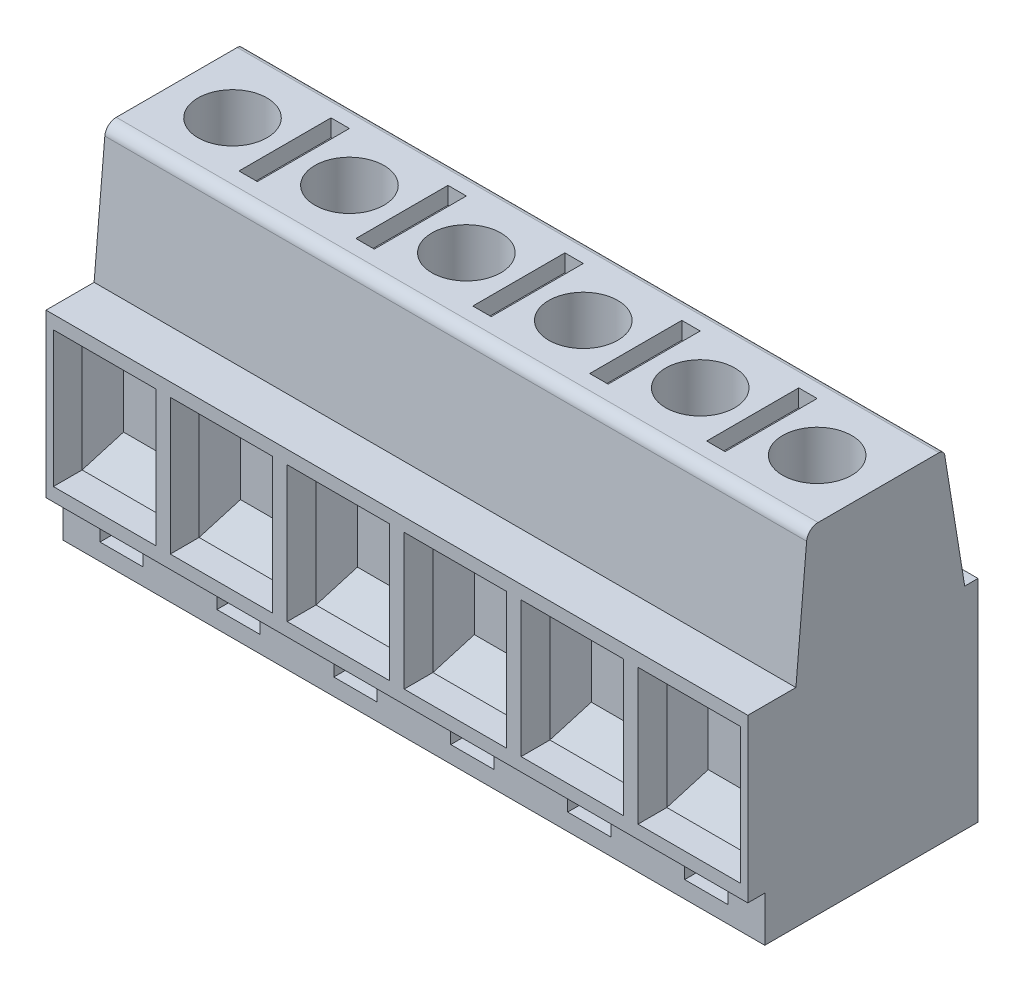
from build123d import *

# Parameters (mm, degrees)
BOSS_EXTRUDE1_DEPTH     = 10.16
SKETCH2_W               = 8.900000000000002
SKETCH2_H               = 11.800000000000011
CUT_EXTRUDE1_DEPTH      = 2.5
SKETCH5_R               = 2.9999999999999996
CUT_EXTRUDE2_DEPTH      = 5.7
SKETCH7_W               = 1.2999999999999998
SKETCH7_H               = 0.8000000000000007
SKETCH7_H_2             = 0.7999999999999936
BOSS_EXTRUDE2_DEPTH     = 4.5
CUT_EXTRUDE5_START      = -10.96
CUT_EXTRUDE5_DEPTH      = 10.96
SKETCH10_R              = 1.4999999999999998
CUT_EXTRUDE6_DEPTH      = 4.5
SKETCH13_W              = 3.75
SKETCH13_H              = 1
CUT_EXTRUDE8_DEPTH      = 3
FILLET3_R               = 0.5
FILLET4_R               = 1
SKETCH12_W              = 1.2999999999999998
SKETCH12_H              = 1.299999999999999
BOSS_EXTRUDE3_DEPTH     = 0.5
BOSS_EXTRUDE3_2_DEPTH   = 0.5
BOSS_EXTRUDE3_3_DEPTH   = 0.5
BOSS_EXTRUDE4_START     = 0.01
BOSS_EXTRUDE4_DEPTH     = 0.01
LPATTERN8_COUNT         = 6
LPATTERN8_PITCH         = 10.16
LPATTERN8_2_COUNT       = 6
LPATTERN8_2_PITCH       = 10.16
LPATTERN8_3_COUNT       = 6
LPATTERN8_3_PITCH       = 10.16
LPATTERN8_4_COUNT       = 6
LPATTERN8_4_PITCH       = 10.16
FILLET3_OF_LPATTERN8_R  = 0.5
FILLET4_OF_LPATTERN8_R  = 1
SKETCH11_W              = 1.6
SKETCH11_H              = 8
CUT_EXTRUDE7_DEPTH      = 1.5
LPATTERN9_START         = 57.041856165
LPATTERN9_OUTLINE_W     = 1.5999999999999943
LPATTERN9_OUTLINE_H     = 8
LPATTERN9_OUTLINE_W_2   = 1.5999999999999979
LPATTERN9_OUTLINE_W_3   = 1.6000000000000014
LPATTERN9_DEPTH         = 1.5
LPATTERN9_START_2       = 28.541856165
LPATTERN9_2_OUTLINE_W   = 1.2999999999999972
LPATTERN9_2_OUTLINE_H   = 1.299999999999999
LPATTERN9_2_OUTLINE_W_2 = 1.3000000000000007
LPATTERN9_2_OUTLINE_H_2 = 1.2999999999999972
LPATTERN9_2_OUTLINE_H_3 = 1.3000000000000007
LPATTERN9_2_DEPTH       = 0.5
BOSS_EXTRUDE6_DEPTH     = 0.01


# Read off the part's stored shape, not the designer's step: Cut-Extrude5, LPattern9
with BuildPart() as part:
    # Sketch1 → Boss-Extrude1 (new body)
    with BuildSketch(Plane(origin=(0, 0, 0), x_dir=(0, 0, -1), z_dir=(1, 0, 0))):
        Polygon((9.669213470381848, 32.96915259715871), (9.669213470381848, 47.08678337249189), (13.847501539912686, 47.08678337249189), (14.859335014289963, 58.54185616450892), (26.70903057031256, 58.54185616450892), (28.514863984729242, 47.38649061080074), (29.669213470381848, 47.38649061080074), (29.66921347038185, 29.041856164508925), (11.142277404209432, 29.04185616450892), (11.142277404209432, 32.96915259715871), align=None)
    boss_extrude1 = extrude(amount=BOSS_EXTRUDE1_DEPTH)

    # Sketch2 → Cut-Extrude1 (cut)
    with BuildSketch(Plane.XY.offset(-9.669213470381848)):
        with Locations((5.08, 40.0279679848253)):
            Rectangle(SKETCH2_W, SKETCH2_H)
    cut_extrude1 = extrude(amount=-CUT_EXTRUDE1_DEPTH, mode=Mode.SUBTRACT)

    # Sketch3 → Cut-Loft1 section 0
    with BuildSketch(Plane.XY.offset(-12.169213470381848)):
        with BuildLine():
            Line((9.530000000000001, 34.1279679848253), (9.530000000000001, 45.92796798482531))
            Line((9.530000000000001, 45.92796798482531), (0.6299999999999994, 45.92796798482531))
            Line((0.6299999999999994, 45.92796798482531), (0.6299999999999994, 34.1279679848253))
            Line((0.6299999999999994, 34.1279679848253), (9.530000000000001, 34.1279679848253))
        make_face()
    # Sketch4 → Cut-Loft1 section 1
    with BuildSketch(Plane.XY.offset(-14.069213470381849)):
        with BuildLine():
            Line((2.3299999999999987, 36.877967984825304), (7.829999999999998, 36.877967984825304))
            Line((7.829999999999998, 36.877967984825304), (7.829999999999998, 43.1779679848253))
            Line((7.829999999999998, 43.1779679848253), (2.3299999999999987, 43.1779679848253))
            Line((2.3299999999999987, 43.1779679848253), (2.3299999999999987, 36.877967984825304))
        make_face()
    cut_loft1 = loft(mode=Mode.SUBTRACT)

    # Sketch5 → Cut-Extrude2 (cut)
    with BuildSketch(Plane(origin=(0, 58.54185616450892, 0), x_dir=(1, 0, 0), z_dir=(0, 1, 0))):
        with Locations(Location((5.08, 20.784182792301262, 0), (0, 0, 270))):
            Circle(SKETCH5_R)
    cut_extrude2 = extrude(amount=-CUT_EXTRUDE2_DEPTH, mode=Mode.SUBTRACT)

    # Sketch7 → Boss-Extrude2 (add)
    with BuildSketch(Plane.XZ.offset(-29.041856164508918)):
        with Locations((5.08, -27.169213470381862)):
            Rectangle(SKETCH7_W, SKETCH7_H)
        with Locations((5.08, -17.00921347038186)):
            Rectangle(SKETCH7_W, SKETCH7_H_2)
    boss_extrude2 = extrude(amount=BOSS_EXTRUDE2_DEPTH)

    # Cut-Extrude5 outline → Cut-Extrude5 (cut)
    with BuildSketch(Plane.XY.offset(-16.60921347038186).offset(CUT_EXTRUDE5_START)):
        with BuildLine():
            Line((5.73, 24.541856165), (5.73, 25.191856165))
            ThreePointArc((5.73, 25.191856165), (5.539619408, 24.732236757), (5.08, 24.541856165))
            Line((5.08, 24.541856165), (5.73, 24.541856165))
        make_face()
        with BuildLine():
            Line((4.43, 24.541856165), (5.08, 24.541856165))
            ThreePointArc((5.08, 24.541856165), (4.620380592, 24.732236757), (4.43, 25.191856165))
            Line((4.43, 25.191856165), (4.43, 24.541856165))
        make_face()
    cut_extrude5 = extrude(amount=CUT_EXTRUDE5_DEPTH, mode=Mode.SUBTRACT)

    # Sketch10 → Cut-Extrude6 (cut)
    with BuildSketch(Plane(origin=(0, 38.527852040591384, -38.527852040591256), x_dir=(-1, 0, 0), z_dir=(0, 0.7071067811865488, -0.7071067811865464))):
        with Locations(Location((-5.08, 12.528006810151506, 0), (0, 0, 90))):
            Circle(SKETCH10_R)
    cut_extrude6 = extrude(amount=-CUT_EXTRUDE6_DEPTH, mode=Mode.SUBTRACT)

    # Sketch13 → Cut-Extrude8 (cut)
    with BuildSketch(Plane.XY.offset(-11.142277404209432)):
        with Locations((5.080000000000007, 31.005504380833823)):
            Rectangle(SKETCH13_W, SKETCH13_H)
    cut_extrude8 = extrude(amount=-CUT_EXTRUDE8_DEPTH, mode=Mode.SUBTRACT)

    # Fillet3
    fillet3_edges = [part.edges().sort_by_distance(p)[0] for p in [
        (5.08, 58.54185616450892, -26.70903057031256),
    ]]
    fillet(fillet3_edges, radius=FILLET3_R)

    # Fillet4
    fillet4_edges = [part.edges().sort_by_distance(p)[0] for p in [
        (5.08, 58.54185616450892, -14.859335014289963),
    ]]
    fillet(fillet4_edges, radius=FILLET4_R)

    # Sketch14 → Boss-Extrude4 (add)
    with BuildSketch(Plane(origin=(10.16, 0, 0), x_dir=(0, 0, -1), z_dir=(1, 0, 0)).offset(BOSS_EXTRUDE4_START)):
        with BuildLine():
            Line((14.77877644669124, 57.629844179105966), (13.847501539912686, 47.08678337249189))
            Line((13.847501539912686, 47.08678337249189), (9.669213470381848, 47.08678337249189))
            Line((9.669213470381848, 47.08678337249189), (9.669213470381848, 32.96915259715871))
            Line((9.669213470381848, 32.96915259715871), (11.142277404209432, 32.96915259715871))
            Line((11.142277404209432, 32.96915259715871), (11.142277404209432, 29.04185616450892))
            Line((11.142277404209432, 29.04185616450892), (29.66921347038185, 29.041856164508925))
            Line((29.66921347038185, 29.041856164508925), (29.669213470381848, 47.38649061080074))
            Line((29.669213470381848, 47.38649061080074), (28.514863984729242, 47.38649061080074))
            Line((28.514863984729242, 47.38649061080074), (26.777036465378647, 58.121756163471794))
            ThreePointArc((26.777036465378647, 58.121756163471794), (26.607537368480997, 58.42261199143836), (26.28346175961899, 58.54185616450892))
            Line((26.28346175961899, 58.54185616450892), (15.77489798008326, 58.54185616450892))
            ThreePointArc((15.77489798008326, 58.54185616450892), (15.09961582223998, 58.279415658582806), (14.77877644669124, 57.629844179105966))
        make_face()
    extrude(amount=-BOSS_EXTRUDE4_DEPTH)



with BuildPart() as body_2:
    # Sketch12 → Boss-Extrude3 (new body)
    with BuildSketch(Plane.XZ.offset(-29.041856164508918)):
        with Locations((3.9e-16, -15.192277404209438)):
            Rectangle(SKETCH12_W, SKETCH12_H)
    extrude(amount=BOSS_EXTRUDE3_DEPTH)


with BuildPart() as body_3:
    # Sketch12 → Boss-Extrude3 2 (new body)
    with BuildSketch(Plane.XZ.offset(-29.041856164508918)):
        Polygon((-0.6500000000000012, -20.342277404209444), (0.6499999999999989, -20.342277404209444), (0.649999999999998, -19.04227740420944), (-0.6500000000000012, -19.04227740420944), align=None)
    extrude(amount=BOSS_EXTRUDE3_2_DEPTH)


with BuildPart() as body_4:
    # Sketch12 → Boss-Extrude3 3 (new body)
    with BuildSketch(Plane.XZ.offset(-29.041856164508918)):
        Polygon((-0.6499999999999996, -25.042277404209447), (0.6500000000000006, -25.042277404209447), (0.6500000000000008, -23.742277404209442), (-0.6499999999999996, -23.742277404209442), align=None)
    extrude(amount=BOSS_EXTRUDE3_3_DEPTH)


with BuildPart() as part_1:
    add(part.part)

    add(body_2.part)  # LPattern8 merges body 2

    add(body_3.part)  # LPattern8 merges body 3

    add(body_4.part)  # LPattern8 merges body 4
    # LPattern8: Boss-Extrude1 ×6
    with Locations(*[(-i * LPATTERN8_PITCH, 0, 0) for i in range(1, LPATTERN8_COUNT)]):
        add(boss_extrude1)

    # LPattern8 2: Cut-Extrude1, Cut-Loft1, Cut-Extrude2 ×6
    with Locations(*[(-i * LPATTERN8_2_PITCH, 0, 0) for i in range(1, LPATTERN8_2_COUNT)]):
        add(cut_extrude1, mode=Mode.SUBTRACT)
        add(cut_loft1, mode=Mode.SUBTRACT)
        add(cut_extrude2, mode=Mode.SUBTRACT)

    # LPattern8 3: Boss-Extrude2 ×6
    with Locations(*[(-i * LPATTERN8_3_PITCH, 0, 0) for i in range(1, LPATTERN8_3_COUNT)]):
        add(boss_extrude2)

    # LPattern8 4: Cut-Extrude5, Cut-Extrude6, Cut-Extrude8 ×6
    with Locations(*[(-i * LPATTERN8_4_PITCH, 0, 0) for i in range(1, LPATTERN8_4_COUNT)]):
        add(cut_extrude5, mode=Mode.SUBTRACT)
        add(cut_extrude6, mode=Mode.SUBTRACT)
        add(cut_extrude8, mode=Mode.SUBTRACT)

    # Fillet3 of LPattern8
    fillet3_of_lpattern8_edges = [part_1.edges().sort_by_distance(p)[0] for p in [
        (-5.08, 58.54185616450892, -26.70903057031256),
        (-15.24, 58.54185616450892, -26.70903057031256),
        (-25.4, 58.54185616450892, -26.70903057031256),
        (-35.56, 58.54185616450892, -26.70903057031256),
        (-45.72, 58.54185616450892, -26.70903057031256),
    ]]
    fillet(fillet3_of_lpattern8_edges, radius=FILLET3_OF_LPATTERN8_R)

    # Fillet4 of LPattern8
    fillet4_of_lpattern8_edges = [part_1.edges().sort_by_distance(p)[0] for p in [
        (-5.08, 58.54185616450892, -14.859335014289963),
        (-15.24, 58.54185616450892, -14.859335014289963),
        (-25.4, 58.54185616450892, -14.859335014289963),
        (-35.56, 58.54185616450892, -14.859335014289963),
        (-45.72, 58.54185616450892, -14.859335014289963),
    ]]
    fillet(fillet4_of_lpattern8_edges, radius=FILLET4_OF_LPATTERN8_R)

    # Sketch11 → Cut-Extrude7 (cut)
    with BuildSketch(Plane(origin=(0, 58.54185616450892, 0), x_dir=(1, 0, 0), z_dir=(0, 1, 0))):
        with Locations((4.16e-15, 21.064117563348077)):
            Rectangle(SKETCH11_W, SKETCH11_H)
    extrude(amount=-CUT_EXTRUDE7_DEPTH, mode=Mode.SUBTRACT)

    # LPattern9 outline → LPattern9 (cut)
    with BuildSketch(Plane(origin=(0, 0, 0), x_dir=(1, 0, 0), z_dir=(0, 1, 0)).offset(LPATTERN9_START)):
        with Locations((-40.64, 21.064117563)):
            Rectangle(LPATTERN9_OUTLINE_W, LPATTERN9_OUTLINE_H)
        with Locations((-30.480000000000004, 21.064117563)):
            Rectangle(LPATTERN9_OUTLINE_W_2, LPATTERN9_OUTLINE_H)
        with Locations((-20.32, 21.064117563)):
            Rectangle(LPATTERN9_OUTLINE_W_3, LPATTERN9_OUTLINE_H)
        with Locations((-10.16, 21.064117563)):
            Rectangle(LPATTERN9_OUTLINE_W_3, LPATTERN9_OUTLINE_H)
    extrude(amount=LPATTERN9_DEPTH, mode=Mode.SUBTRACT)

    # LPattern9 2 outline → LPattern9 2 (add)
    with BuildSketch(Plane(origin=(0, 0, 0), x_dir=(1, 0, 0), z_dir=(0, 1, 0)).offset(LPATTERN9_START_2)):
        with Locations((-40.64, 15.192277404000002)):
            Rectangle(LPATTERN9_2_OUTLINE_W, LPATTERN9_2_OUTLINE_H)
        with Locations((-30.479999999999997, 15.192277404000002)):
            Rectangle(LPATTERN9_2_OUTLINE_W, LPATTERN9_2_OUTLINE_H)
        with Locations((-20.32, 15.192277404000002)):
            Rectangle(LPATTERN9_2_OUTLINE_W, LPATTERN9_2_OUTLINE_H)
        with Locations((-10.16, 15.192277404000002)):
            Rectangle(LPATTERN9_2_OUTLINE_W_2, LPATTERN9_2_OUTLINE_H)
        with Locations((-40.64, 24.392277404)):
            Rectangle(LPATTERN9_2_OUTLINE_W, LPATTERN9_2_OUTLINE_H_2)
        with Locations((-40.64, 19.692277404000002)):
            Rectangle(LPATTERN9_2_OUTLINE_W, LPATTERN9_2_OUTLINE_H_3)
        with Locations((-30.479999999999997, 24.392277404)):
            Rectangle(LPATTERN9_2_OUTLINE_W, LPATTERN9_2_OUTLINE_H_2)
        with Locations((-30.479999999999997, 19.692277404000002)):
            Rectangle(LPATTERN9_2_OUTLINE_W, LPATTERN9_2_OUTLINE_H_3)
        with Locations((-20.32, 24.392277404)):
            Rectangle(LPATTERN9_2_OUTLINE_W, LPATTERN9_2_OUTLINE_H_2)
        with Locations((-20.32, 19.692277404000002)):
            Rectangle(LPATTERN9_2_OUTLINE_W, LPATTERN9_2_OUTLINE_H_3)
        with Locations((-10.16, 24.392277404)):
            Rectangle(LPATTERN9_2_OUTLINE_W_2, LPATTERN9_2_OUTLINE_H_2)
        with Locations((-10.16, 19.692277404000002)):
            Rectangle(LPATTERN9_2_OUTLINE_W_2, LPATTERN9_2_OUTLINE_H_3)
    extrude(amount=LPATTERN9_2_DEPTH)

    # Sketch16 → Boss-Extrude6 (add)
    with BuildSketch(Plane.ZY.offset(50.800000000000004)):
        with BuildLine():
            Line((-13.847501539912686, 47.08678337249189), (-14.77877644669124, 57.629844179105966))
            ThreePointArc((-14.77877644669124, 57.629844179105966), (-15.09961582223998, 58.279415658582806), (-15.77489798008326, 58.54185616450892))
            Line((-15.77489798008326, 58.54185616450892), (-26.28346175961899, 58.54185616450892))
            ThreePointArc((-26.28346175961899, 58.54185616450892), (-26.607537368480997, 58.42261199143836), (-26.777036465378647, 58.121756163471794))
            Line((-26.777036465378647, 58.121756163471794), (-28.514863984729242, 47.38649061080074))
            Line((-28.514863984729242, 47.38649061080074), (-29.669213470381848, 47.38649061080074))
            Line((-29.669213470381848, 47.38649061080074), (-29.66921347038185, 29.041856164508925))
            Line((-29.66921347038185, 29.041856164508925), (-11.142277404209432, 29.04185616450892))
            Line((-11.142277404209432, 29.04185616450892), (-11.142277404209432, 32.96915259715871))
            Line((-11.142277404209432, 32.96915259715871), (-9.669213470381848, 32.96915259715871))
            Line((-9.669213470381848, 32.96915259715871), (-9.669213470381848, 47.08678337249189))
            Line((-9.669213470381848, 47.08678337249189), (-13.847501539912686, 47.08678337249189))
        make_face()
    extrude(amount=BOSS_EXTRUDE6_DEPTH)


solid = part_1.part
